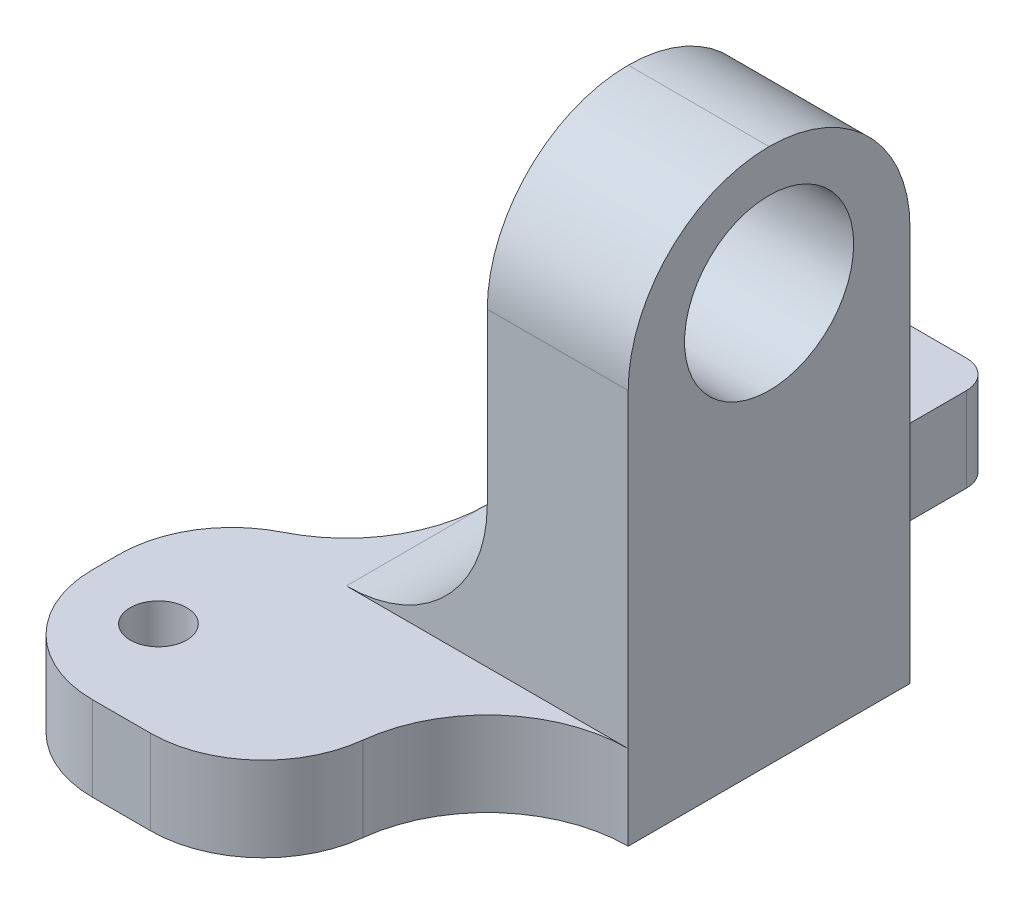
from build123d import *

# Parameters (mm, degrees)
SKETCH1_W           = 15
SKETCH1_H           = 26
BOSS_EXTRUDE1_DEPTH = 3
CUT_EXTRUDE1_REACH  = 39.924
SKETCH2_R           = 1
SKETCH3_W           = 5
SKETCH3_H           = 10
BOSS_EXTRUDE2_DEPTH = 16
CUT_EXTRUDE2_REACH  = 29.477
SKETCH4_R           = 3
CUT_EXTRUDE3_REACH  = 43.052
SKETCH5_W           = 5
SKETCH5_H           = 8
SKETCH5_H_2         = 18
FILLET1_R           = 5
FILLET2_R           = 5
FILLET3_R           = 5
FILLET4_R           = 4
FILLET5_R           = 1


with BuildPart() as part:
    # Sketch1 → Boss-Extrude1 (new body)
    with BuildSketch(Plane(origin=(0, 0, 0), x_dir=(1, 0, 0), z_dir=(0, 1, 0))):
        with Locations((-28.000171023, 0)):
            Rectangle(SKETCH1_W, SKETCH1_H)
    extrude(amount=BOSS_EXTRUDE1_DEPTH)

    # Sketch2 → Cut-Extrude1 (cut, up to next)
    with BuildSketch(Plane(origin=(0, 3, 0), x_dir=(1, 0, 0), z_dir=(0, 1, 0)), mode=Mode.PRIVATE) as cut_extrude1_sk1:
        with Locations(Location((-32.666666667, -9.5, 0), (0, 0, 270))):
            Circle(SKETCH2_R)
    cut_extrude1_tool1 = extrude(cut_extrude1_sk1.sketch, amount=-CUT_EXTRUDE1_REACH, mode=Mode.PRIVATE) & part.part
    # Sketch2 → Cut-Extrude1 (cut, up to next)
    with BuildSketch(Plane(origin=(0, 3, 0), x_dir=(1, 0, 0), z_dir=(0, 1, 0)), mode=Mode.PRIVATE) as cut_extrude1_sk2:
        with Locations(Location((-28, 10.5, 0), (0, 0, 270))):
            Circle(SKETCH2_R)
    cut_extrude1_tool2 = extrude(cut_extrude1_sk2.sketch, amount=-CUT_EXTRUDE1_REACH, mode=Mode.PRIVATE) & part.part
    add(cut_extrude1_tool1.solids().sort_by_distance((-32.666667, 3, 9.5))[0], mode=Mode.SUBTRACT)
    add(cut_extrude1_tool2.solids().sort_by_distance((-28, 3, -10.5))[0], mode=Mode.SUBTRACT)

    # Sketch3 → Boss-Extrude2 (add)
    with BuildSketch(Plane(origin=(0, 3, 0), x_dir=(1, 0, 0), z_dir=(0, 1, 0))):
        with Locations((-23.000171023, 0)):
            Rectangle(SKETCH3_W, SKETCH3_H)
    extrude(amount=BOSS_EXTRUDE2_DEPTH)

    # Sketch4 → Cut-Extrude2 (cut, up to next)
    with BuildSketch(Plane(origin=(-20.500171023, 0, 0), x_dir=(0, 0, -1), z_dir=(1, 0, 0)), mode=Mode.PRIVATE) as cut_extrude2_sk1:
        with Locations((0, 14.5)):
            Circle(SKETCH4_R)
    cut_extrude2_tool1 = extrude(cut_extrude2_sk1.sketch, amount=-CUT_EXTRUDE2_REACH, mode=Mode.PRIVATE) & part.part
    add(cut_extrude2_tool1.solids().sort_by_distance((-20.500171, 14.5, 0))[0], mode=Mode.SUBTRACT)

    # Sketch5 → Cut-Extrude3 (cut, up to next)
    with BuildSketch(Plane(origin=(0, 3, 0), x_dir=(1, 0, 0), z_dir=(0, 1, 0)), mode=Mode.PRIVATE) as cut_extrude3_sk1:
        with Locations((-23.000171023, 9)):
            Rectangle(SKETCH5_W, SKETCH5_H)
    cut_extrude3_tool1 = extrude(cut_extrude3_sk1.sketch, amount=-CUT_EXTRUDE3_REACH, mode=Mode.PRIVATE) & part.part
    # Sketch5 → Cut-Extrude3 (cut, up to next)
    with BuildSketch(Plane(origin=(0, 3, 0), x_dir=(1, 0, 0), z_dir=(0, 1, 0)), mode=Mode.PRIVATE) as cut_extrude3_sk2:
        with Locations((-33.000171023, 4)):
            Rectangle(SKETCH5_W, SKETCH5_H_2)
    cut_extrude3_tool2 = extrude(cut_extrude3_sk2.sketch, amount=-CUT_EXTRUDE3_REACH, mode=Mode.PRIVATE) & part.part
    # Sketch5 → Cut-Extrude3 (cut, up to next)
    with BuildSketch(Plane(origin=(0, 3, 0), x_dir=(1, 0, 0), z_dir=(0, 1, 0)), mode=Mode.PRIVATE) as cut_extrude3_sk3:
        with Locations((-23.000171023, -9)):
            Rectangle(SKETCH5_W, SKETCH5_H)
    cut_extrude3_tool3 = extrude(cut_extrude3_sk3.sketch, amount=-CUT_EXTRUDE3_REACH, mode=Mode.PRIVATE) & part.part
    add(cut_extrude3_tool1.solids().sort_by_distance((-23.000171, 3, -9))[0], mode=Mode.SUBTRACT)
    add(cut_extrude3_tool2.solids().sort_by_distance((-33.000171, 3, -4))[0], mode=Mode.SUBTRACT)
    add(cut_extrude3_tool3.solids().sort_by_distance((-23.000171, 3, 9))[0], mode=Mode.SUBTRACT)

    # Fillet1
    fillet1_edges = [part.edges().sort_by_distance(p)[0] for p in [
        (-23.000171023, 19, -5),
        (-23.000171023, 19, 5),
    ]]
    fillet(fillet1_edges, radius=FILLET1_R - 0.0001)  # a hair under: the kernel refuses the full size

    # Fillet2
    fillet2_edges = [part.edges().sort_by_distance(p)[0] for p in [
        (-25.500171023, 3, 0),
    ]]
    fillet(fillet2_edges, radius=FILLET2_R - 0.0001)  # a hair under: the kernel refuses the full size

    # Fillet3
    fillet3_edges = [part.edges().sort_by_distance(p)[0] for p in [
        (-30.500171023, 1.5, 5),
        (-25.500171023, 1.5, -5),
        (-25.500171023, 1.5, 5),
    ]]
    fillet(fillet3_edges, radius=FILLET3_R - 0.0001)  # a hair under: the kernel refuses the full size

    # Fillet4
    fillet4_edges = [part.edges().sort_by_distance(p)[0] for p in [
        (-35.500171023, 1.5, 5),
        (-35.500171023, 1.5, 13),
        (-25.500171023, 1.5, 13),
    ]]
    fillet(fillet4_edges, radius=FILLET4_R)

    # Fillet5
    fillet5_edges = [part.edges().sort_by_distance(p)[0] for p in [
        (-30.500171023, 1.5, -13),
        (-25.500171023, 1.5, -13),
    ]]
    fillet(fillet5_edges, radius=FILLET5_R)


solid = part.part
